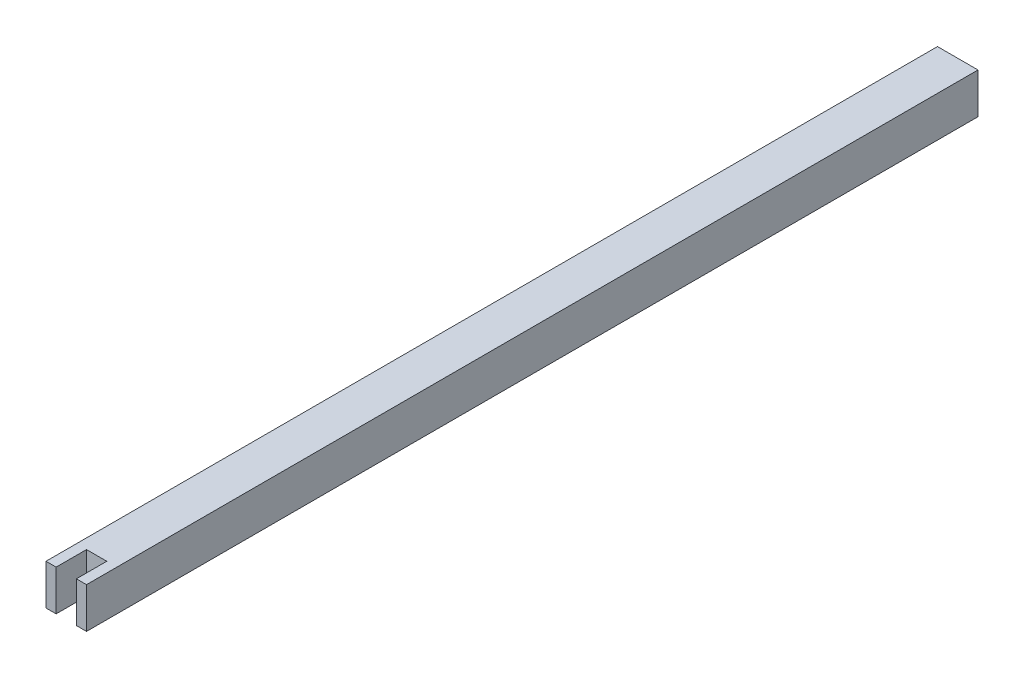
from build123d import *

# Parameters (mm, degrees)
ESQUISSE1_W             = 100
ESQUISSE1_H             = 100
BOSS_EXTRU_1_DEPTH      = 2200
ESQUISSE2_W             = 50
ESQUISSE2_H             = 75
ENL_V_MAT_EXTRU_1_DEPTH = 2205.540768505


with BuildPart() as part:
    # Esquisse1 → Boss.-Extru.1 (new body)
    with BuildSketch(Plane.XY):
        with Locations((50, 50)):
            Rectangle(ESQUISSE1_W, ESQUISSE1_H)
    extrude(amount=BOSS_EXTRU_1_DEPTH)

    # Esquisse2 → Enlèv. mat.-Extru.1 (cut, through all)
    with BuildSketch(Plane.XZ):
        with Locations((50, 2162.5)):
            Rectangle(ESQUISSE2_W, ESQUISSE2_H)
    extrude(amount=-ENL_V_MAT_EXTRU_1_DEPTH, mode=Mode.SUBTRACT)


solid = part.part
